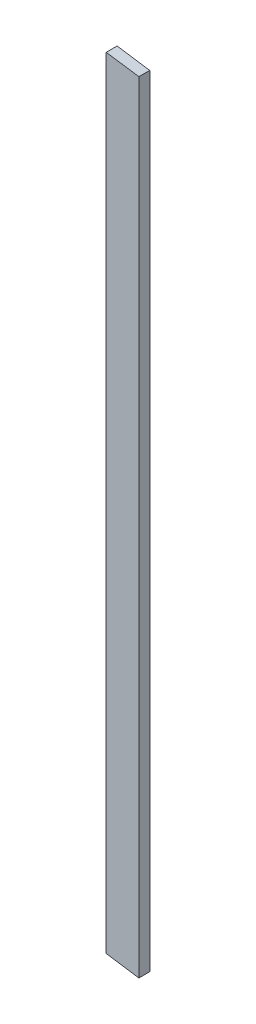
from build123d import *

# Parameters (mm, degrees)
ESQUISSE1_W             = 38.1
ESQUISSE1_H             = 1219.2
BOSS_EXTRU_1_DEPTH      = 12.7
ENL_V_START             = -12.7
ENL_V_MAT_EXTRU_1_DEPTH = 12.7


# Read off the part's stored shape, not the designer's step: Enlèv. mat.-Extru.1
with BuildPart() as part:
    # Esquisse1 → Boss.-Extru.1 (new body)
    with BuildSketch(Plane.XY):
        Rectangle(ESQUISSE1_W, ESQUISSE1_H)
    extrude(amount=BOSS_EXTRU_1_DEPTH)

    # Enlèv. mat.-Extru.1 outline → Enlèv. mat.-Extru.1 (cut)
    with BuildSketch(Plane.XY.offset(12.7).offset(ENL_V_START)):
        Polygon((-19.05, 307.566269395), (19.05, 301.933356), (19.05, 609.6), (-19.05, 609.6), align=None)
        Polygon((-19.05, -609.6), (19.05, -609.6), (-19.05, -603.967086605), align=None)
    extrude(amount=ENL_V_MAT_EXTRU_1_DEPTH, mode=Mode.SUBTRACT)


solid = part.part
